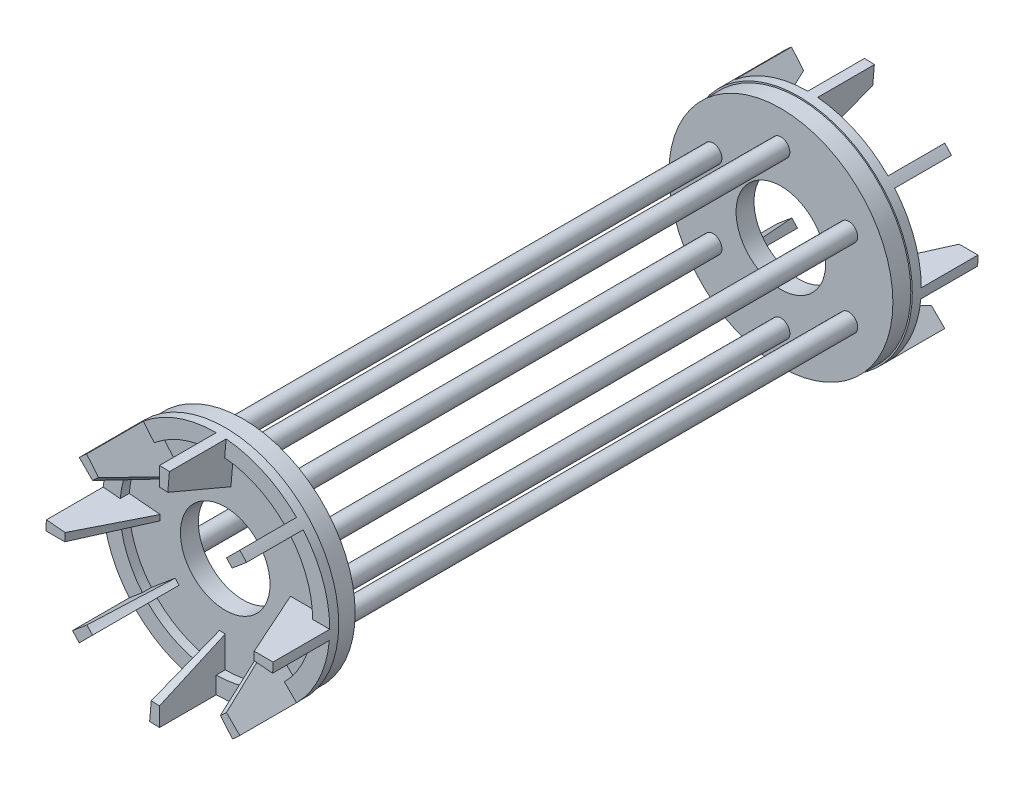
from build123d import *
from build123d.topology import SkipClean

# Parameters (mm, degrees)
SKETCH1_R           = 12.5
SKETCH1_R_2         = 5
BOSS_EXTRUDE1_DEPTH = 2
SKETCH3_R           = 12.665926605
SKETCH3_R_2         = 10.754079628
BOSS_EXTRUDE4_DEPTH = 1
REVOLVE1_ANGLE      = 5
CIRPATTERN1_COUNT   = 8
SKETCH5_R           = 1
BOSS_EXTRUDE5_DEPTH = 30
CIRPATTERN2_COUNT   = 6


with BuildPart() as part:
    # Sketch1 → Boss-Extrude1 (new body)
    with BuildSketch(Plane.XY):
        Circle(SKETCH1_R)
        Circle(SKETCH1_R_2, mode=Mode.SUBTRACT)
    extrude(amount=BOSS_EXTRUDE1_DEPTH)

    # Sketch3 → Boss-Extrude4 (add)
    with BuildSketch(Plane.XY.offset(2)):
        Circle(SKETCH3_R)
        Circle(SKETCH3_R_2, mode=Mode.SUBTRACT)
    extrude(amount=BOSS_EXTRUDE4_DEPTH)

    # Sketch4 → Revolve1 (revolve)
    with SkipClean():  # the faces are left unmerged after this step: merging them gives an invalid solid
        with BuildSketch(Plane(origin=(0, 0, 0), x_dir=(0, 0, -1), z_dir=(1, 0, 0))):
            Polygon((-9.330054786, 12.665926605), (-9.330054786, 10.565877972), (-2, 7.285294012), (-2, 12.665926605), align=None)
        revolve1 = revolve(axis=Axis((0, 0, 9.312529427), (0, 0, -1)), revolution_arc=REVOLVE1_ANGLE)
    add(part.part.scale(1), mode=Mode.REPLACE)  # the faces are merged on a copy

    # CirPattern1: Revolve1 ×8 about axis
    cirpattern1_axis = Axis((0, 0, 9.312529427), (0, 0, -1))
    for i in range(1, CIRPATTERN1_COUNT):
        add(revolve1.rotate(cirpattern1_axis, i * 360 / CIRPATTERN1_COUNT))

    # Sketch5 → Boss-Extrude5 (add)
    with BuildSketch(Plane(origin=(0, 0, 0), x_dir=(-1, 0, 0), z_dir=(0, 0, -1))):
        with Locations((0, 8.75)):
            Circle(SKETCH5_R)
    boss_extrude5 = extrude(amount=BOSS_EXTRUDE5_DEPTH)

    # CirPattern2: Boss-Extrude5 ×6 about axis
    cirpattern2_axis = Axis((0, 0, 9.312529427), (0, 0, -1))
    for i in range(1, CIRPATTERN2_COUNT):
        add(boss_extrude5.rotate(cirpattern2_axis, i * 360 / CIRPATTERN2_COUNT))

    # Mirror4: part across plane


with BuildPart() as part_1:
    add(part.part)
    add(part.part.mirror(Plane.XY.offset(-30)))


solid = part_1.part
